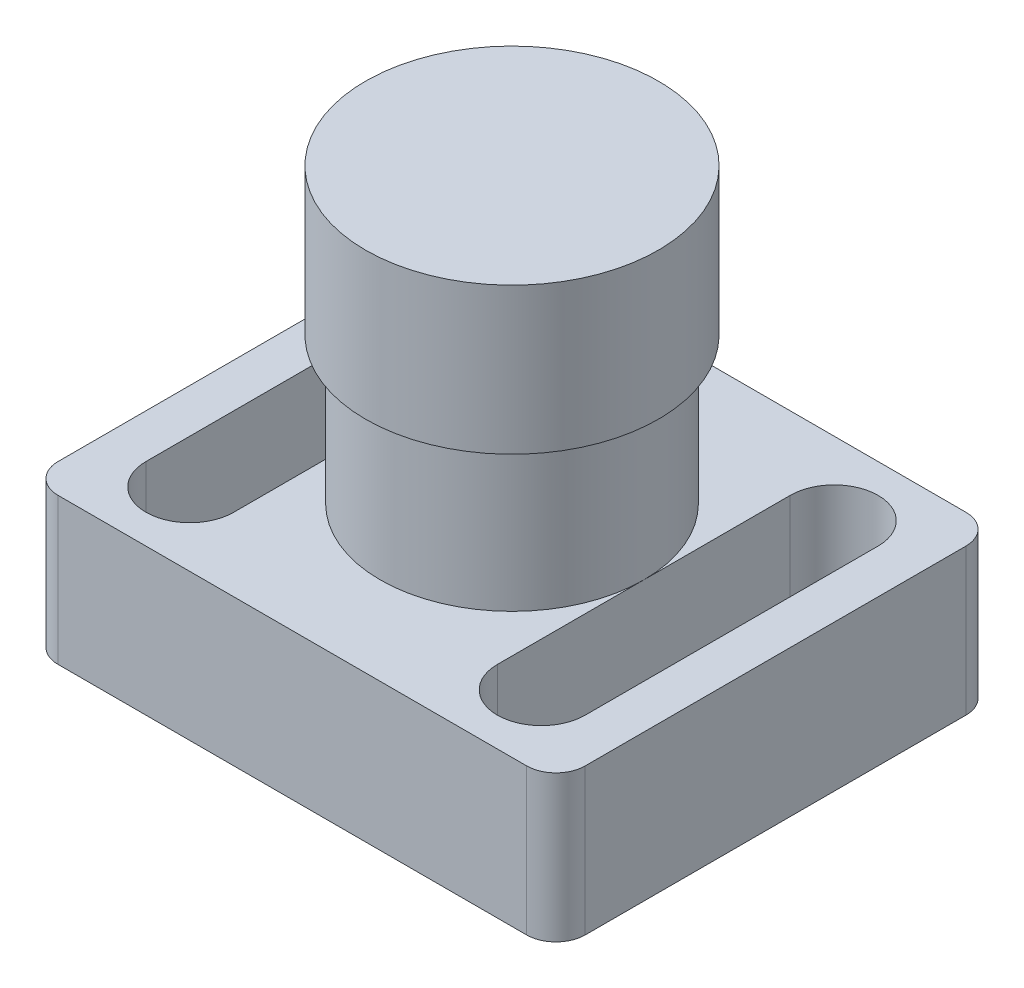
from build123d import *

# Parameters (mm, degrees)
BOSS_EXTRUDE1_DEPTH = 5
SKETCH1_5_R         = 4
CUT_EXTRUDE2_DEPTH  = 13.737739203
SKETCH1_6_R         = 4
BOSS_EXTRUDE4_DEPTH = 10
SKETCH3_R           = 5
BOSS_EXTRUDE5_DEPTH = 5


with BuildPart() as part:
    # Sketch1 → Boss-Extrude1 (new body)
    with BuildSketch(Plane(origin=(0, 0, 0), x_dir=(1, 0, 0), z_dir=(0, 1, 0))):
        with BuildLine():
            Line((8, 7.5), (-8, 7.5))
            ThreePointArc((-8, 7.5), (-8.707106781, 7.207106781), (-9, 6.5))
            Line((-9, 6.5), (-9, -6.5))
            ThreePointArc((-9, -6.5), (-8.707106781, -7.207106781), (-8, -7.5))
            Line((-8, -7.5), (8, -7.5))
            ThreePointArc((8, -7.5), (8.707106781, -7.207106781), (9, -6.5))
            Line((9, -6.5), (9, 6.5))
            ThreePointArc((9, 6.5), (8.707106781, 7.207106781), (8, 7.5))
        make_face()
    extrude(amount=BOSS_EXTRUDE1_DEPTH)

    # Sketch1<5> → Cut-Extrude2 (cut, through all)
    with BuildSketch(Plane(origin=(0, 0, 0), x_dir=(1, 0, 0), z_dir=(0, 1, 0))):
        with BuildLine():
            Line((-4.5, -5), (-4.5, 5))
            ThreePointArc((-4.5, 5), (-6, 6.5), (-7.5, 5))
            Line((-7.5, 5), (-7.5, -5))
            ThreePointArc((-7.5, -5), (-6, -6.5), (-4.5, -5))
        make_face()
        with BuildLine():
            Line((4.5, 5), (4.5, -5))
            ThreePointArc((4.5, -5), (6, -6.5), (7.5, -5))
            Line((7.5, -5), (7.5, 5))
            ThreePointArc((7.5, 5), (6, 6.5), (4.5, 5))
        make_face()
        Circle(SKETCH1_5_R)
    extrude(amount=CUT_EXTRUDE2_DEPTH, mode=Mode.SUBTRACT)

    # Sketch1<6> → Boss-Extrude4 (add)
    with BuildSketch(Plane(origin=(0, 0, 0), x_dir=(1, 0, 0), z_dir=(0, 1, 0))):
        with BuildLine():
            ThreePointArc((-4.5, 4e-09), (-2e-09, -4.5), (4.5, 0))
            ThreePointArc((4.5, 0), (2e-09, 4.5), (-4.5, 4e-09))
        make_face()
        Circle(SKETCH1_6_R, mode=Mode.SUBTRACT)
    extrude(amount=BOSS_EXTRUDE4_DEPTH)

    # Sketch3 → Boss-Extrude5 (add)
    with BuildSketch(Plane(origin=(0, 10, 0), x_dir=(1, 0, 0), z_dir=(0, 1, 0))):
        Circle(SKETCH3_R)
    extrude(amount=BOSS_EXTRUDE5_DEPTH)


solid = part.part
